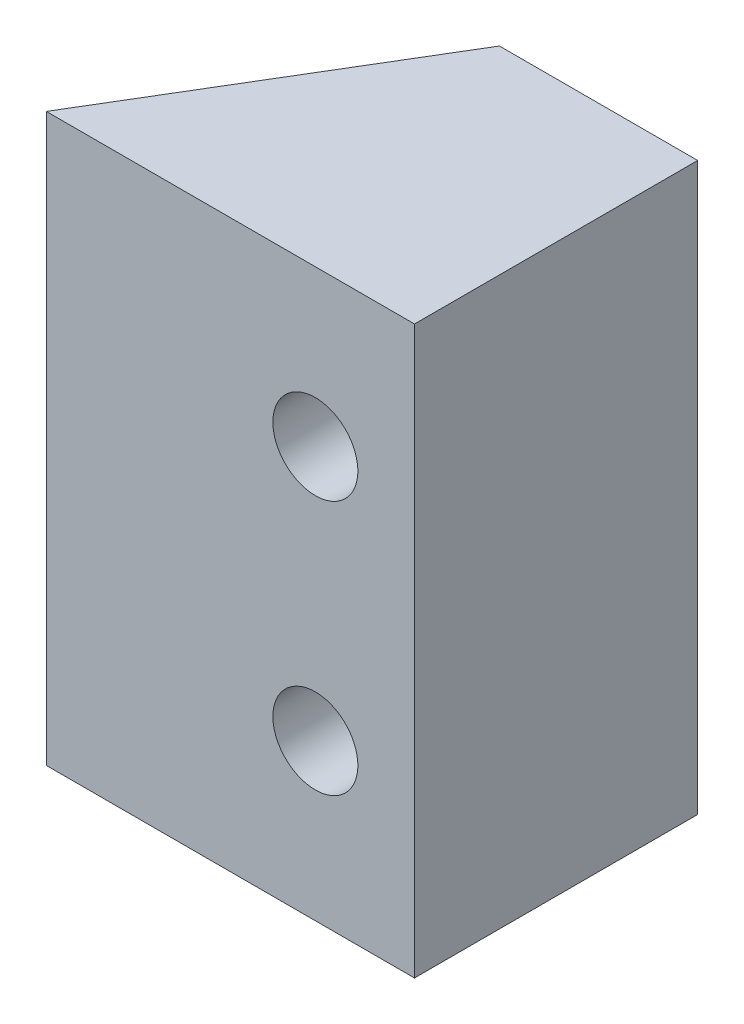
from build123d import *

# Parameters (mm, degrees)
SKETCH1_W           = 13
SKETCH1_H           = 10
BOSS_EXTRUDE1_DEPTH = 20
SKETCH3_R           = 1.5
CUT_EXTRUDE1_DEPTH  = 26.423766585
CUT_EXTRUDE2_DEPTH  = 25.128537435


with BuildPart() as part:
    # Sketch1 → Boss-Extrude1 (new body)
    with BuildSketch(Plane(origin=(0, 0, 0), x_dir=(1, 0, 0), z_dir=(0, 1, 0))):
        with Locations((-5.598260509, -0.984848485)):
            Rectangle(SKETCH1_W, SKETCH1_H)
    extrude(amount=BOSS_EXTRUDE1_DEPTH)

    # Sketch3 → Cut-Extrude1 (cut, through all)
    with BuildSketch(Plane(origin=(0, 0, -4.015151515), x_dir=(-1, 0, 0), z_dir=(0, 0, -1))):
        with Locations((2.598260509, 5.5)):
            Circle(SKETCH3_R)
        with Locations((2.598260509, 14.5)):
            Circle(SKETCH3_R)
    extrude(amount=-CUT_EXTRUDE1_DEPTH, mode=Mode.SUBTRACT)

    # Sketch4 → Cut-Extrude2 (cut, through all)
    with BuildSketch(Plane(origin=(0, 20, 0), x_dir=(1, 0, 0), z_dir=(0, 1, 0))):
        Polygon((-6.098260509, 4.015151515), (-12.098260509, -5.984848485), (-12.098260509, 4.015151515), align=None)
    extrude(amount=-CUT_EXTRUDE2_DEPTH, mode=Mode.SUBTRACT)


solid = part.part
